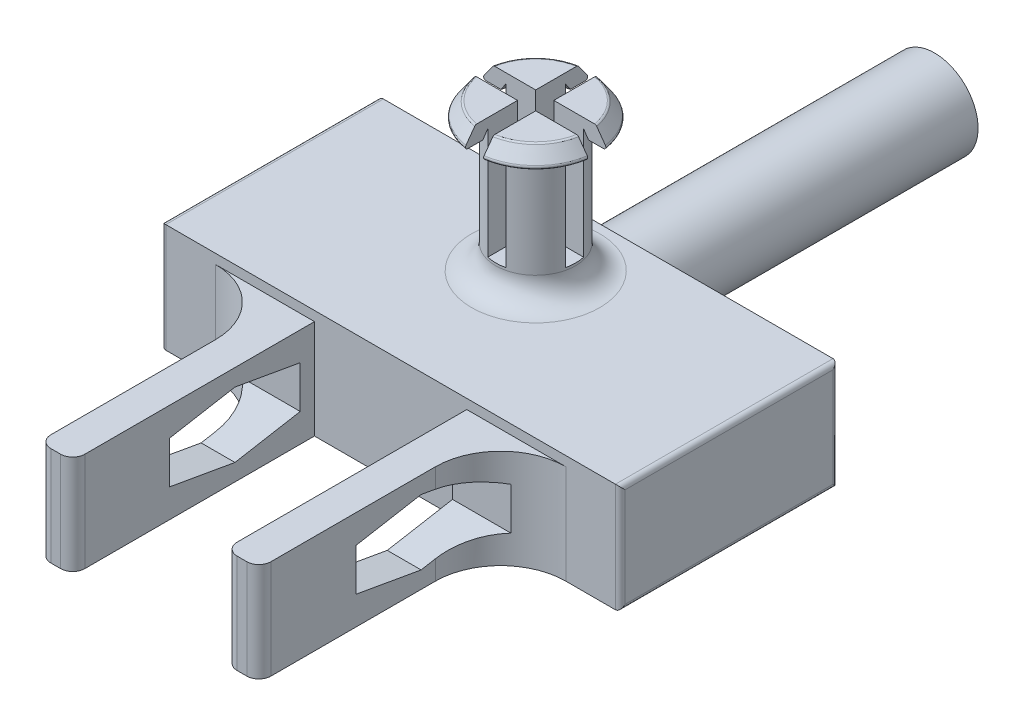
from build123d import *

# Parameters (mm, degrees)
DODANIE_WYCI_GNI_CIE1_DEPTH     = 4.5
DODANIE_WYCI_GNI_CIE2_DEPTH     = 4.1
SZKIC2_R                        = 1.8
DODANIE_WYCI_GNI_CIE3_DEPTH     = 13.5
WYTNIJ_WYCI_GNI_CIE2_DEPTH      = 23.456012558
WYTNIJ_WYCI_GNI_CIE2_DEPTH_BACK = 23.456012558
ZAOKR_GLENIE1_R                 = 0.5
ZAOKR_GLENIE2_R                 = 0.2
SZKIC4_R                        = 1.65
DODANIE_WYCI_GNI_CIE4_DEPTH     = 5.1
SZKIC5_R                        = 1.65
DODANIE_WYCI_GNI_CIE5_DEPTH     = 1
ZAOKR_GLENIE4_R                 = 1
ZAOKR_GLENIE5_R                 = 0.1
WYTNIJ_WYCI_GNI_CIE3_DEPTH      = 5


with BuildPart() as part:
    # Szkic1 → Dodanie-wyciągnięcie1 (new body)
    with BuildSketch(Plane(origin=(0, 0, 0), x_dir=(1, 0, 0), z_dir=(0, 1, 0))):
        Polygon((3.15, -4.5), (4.55, -4.5), (7.25, -4.5), (9.5, -4.5), (9.5, 4.5), (2.579268293, 4.5), (-2.579268293, 4.5), (-9.5, 4.5), (-9.5, -4.5), (-7.25, -4.5), (-4.55, -4.5), (-3.15, -4.5), align=None)
    extrude(amount=DODANIE_WYCI_GNI_CIE1_DEPTH)

    # Szkic1<7> → Dodanie-wyciągnięcie2 (add)
    with BuildSketch(Plane(origin=(0, 0, 0), x_dir=(1, 0, 0), z_dir=(0, 1, 0))):
        with BuildLine():
            Line((4.55, -14.5), (4.55, -7.2))
            ThreePointArc((4.55, -7.2), (5.340811691, -5.290811691), (7.25, -4.5))
            Line((7.25, -4.5), (3.15, -4.5))
            Line((3.15, -4.5), (3.15, -14.5))
            Line((3.15, -14.5), (4.55, -14.5))
        make_face()
        with BuildLine():
            Line((-3.15, -14.5), (-3.15, -4.5))
            Line((-3.15, -4.5), (-7.25, -4.5))
            ThreePointArc((-7.25, -4.5), (-5.340811691, -5.290811691), (-4.55, -7.2))
            Line((-4.55, -7.2), (-4.55, -14.5))
            Line((-4.55, -14.5), (-3.15, -14.5))
        make_face()
    extrude(amount=DODANIE_WYCI_GNI_CIE2_DEPTH)

    # Szkic2 → Dodanie-wyciągnięcie3 (add)
    with BuildSketch(Plane(origin=(0, 0, -4.5), x_dir=(-1, 0, 0), z_dir=(0, 0, -1))):
        with Locations((0, 2.25)):
            Circle(SZKIC2_R)
    extrude(amount=DODANIE_WYCI_GNI_CIE3_DEPTH)

    # Szkic3 → Wytnij-wyciągnięcie2 (cut, two sides: drawn at the far end of the back side and taken through both)
    with BuildSketch(Plane(origin=(-3.15, 0, 0), x_dir=(0, 0, -1), z_dir=(1, 0, 0)).offset(-WYTNIJ_WYCI_GNI_CIE2_DEPTH_BACK)):
        Polygon((-7.790001582, 3.4), (-10.490001582, 2.923917152), (-10.490001582, 1.176082848), (-7.790001582, 0.7), (-5.090001582, 1.176082848), (-5.090001582, 2.923917152), align=None)
    extrude(amount=WYTNIJ_WYCI_GNI_CIE2_DEPTH + WYTNIJ_WYCI_GNI_CIE2_DEPTH_BACK, mode=Mode.SUBTRACT)

    # Zaokrąglenie1
    zaokr_glenie1_edges = [part.edges().sort_by_distance(p)[0] for p in [
        (3.15, 2.05, 14.5),
        (4.55, 2.05, 14.5),
        (-4.55, 2.05, 14.5),
        (-3.15, 2.05, 14.5),
    ]]
    fillet(zaokr_glenie1_edges, radius=ZAOKR_GLENIE1_R)

    # Zaokrąglenie2
    zaokr_glenie2_edges = [part.edges().sort_by_distance(p)[0] for p in [
        (-9.5, 2.25, -4.5),
        (-9.5, 4.5, 0),
        (9.5, 0, 0),
        (-9.5, 2.25, 4.5),
        (9.5, 2.25, 4.5),
        (9.5, 2.25, -4.5),
        (9.5, 4.5, 0),
        (-9.5, 0, 0),
    ]]
    fillet(zaokr_glenie2_edges, radius=ZAOKR_GLENIE2_R)

    # Szkic4 → Dodanie-wyciągnięcie4 (add)
    with BuildSketch(Plane(origin=(0, 4.5, 0), x_dir=(1, 0, 0), z_dir=(0, 1, 0))):
        with Locations((0, 1.5)):
            Circle(SZKIC4_R)
    extrude(amount=DODANIE_WYCI_GNI_CIE4_DEPTH)

    # Szkic5 → Dodanie-wyciągnięcie5 (add)
    with BuildSketch(Plane(origin=(0, 9.6, 0), x_dir=(1, 0, 0), z_dir=(0, 1, 0))):
        with Locations((0, 1.5)):
            Circle(SZKIC5_R)
    extrude(amount=DODANIE_WYCI_GNI_CIE5_DEPTH)

    # Zaokrąglenie4
    zaokr_glenie4_edges = [part.edges().sort_by_distance(p)[0] for p in [
        (-1.65, 4.5, -1.5),
    ]]
    fillet(zaokr_glenie4_edges, radius=ZAOKR_GLENIE4_R)

    # Szkic7 → Obrót1 (revolve)
    with BuildSketch(Plane(origin=(0, 0, 0), x_dir=(0, 0, -1), z_dir=(1, 0, 0))):
        Polygon((3.15, 10.6), (3.65, 10.6), (4.15, 9.9), (3.35, 9.9), (3.15, 10.2), align=None)
    revolve(axis=Axis((0, 16.6, -1.5), (0, -1, 0)))

    # Zaokrąglenie5
    zaokr_glenie5_edges = [part.edges().sort_by_distance(p)[0] for p in [
        (0, 10.6, 0.65),
        (0, 9.9, 1.15),
    ]]
    fillet(zaokr_glenie5_edges, radius=ZAOKR_GLENIE5_R)

    # Szkic6 → Wytnij-wyciągnięcie3 (cut)
    with BuildSketch(Plane(origin=(0, 10.6, 0), x_dir=(1, 0, 0), z_dir=(0, 1, 0))):
        with BuildLine():
            Line((0.375, 4.664465969), (0.375, 1.875))
            Line((0.375, 1.875), (3.164465969, 1.875))
            ThreePointArc((3.164465969, 1.875), (3.186607894, 1.5), (3.164465969, 1.125))
            Line((3.164465969, 1.125), (0.375, 1.125))
            Line((0.375, 1.125), (0.375, -1.664465969))
            ThreePointArc((0.375, -1.664465969), (0, -1.686607894), (-0.375, -1.664465969))
            Line((-0.375, -1.664465969), (-0.375, 1.125))
            Line((-0.375, 1.125), (-3.164465969, 1.125))
            ThreePointArc((-3.164465969, 1.125), (-3.186607894, 1.5), (-3.164465969, 1.875))
            Line((-3.164465969, 1.875), (-0.375, 1.875))
            Line((-0.375, 1.875), (-0.375, 4.664465969))
            ThreePointArc((-0.375, 4.664465969), (0, 4.686607894), (0.375, 4.664465969))
        make_face()
    extrude(amount=-WYTNIJ_WYCI_GNI_CIE3_DEPTH, mode=Mode.SUBTRACT)


solid = part.part
